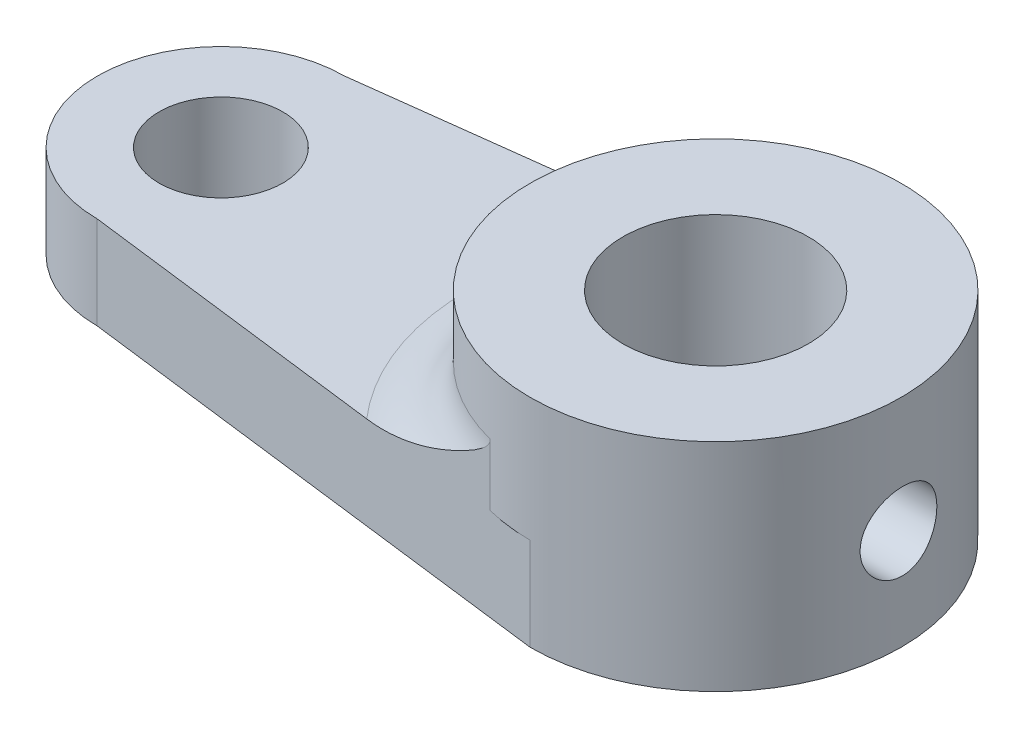
from build123d import *

# Parameters (mm, degrees)
SKETCH1_R                 = 3
SKETCH1_R_2               = 2
BOSS_EXTRUDE1_DEPTH       = 3
SKETCH2_R                 = 6
SKETCH2_R_2               = 3
BOSS_EXTRUDE2_DEPTH       = 4
FILLET1_R                 = 2
M3X0_5_TAPPED_HOLE1_D     = 2.5
M3X0_5_TAPPED_HOLE1_DEPTH = 7.5
M3X0_5_TAPPED_HOLE1_TIP   = 0.751075774


with BuildPart() as part:
    # Sketch1 → Boss-Extrude1 (new body)
    with BuildSketch(Plane(origin=(0, 0, 0), x_dir=(1, 0, 0), z_dir=(0, 1, 0))):
        with BuildLine():
            ThreePointArc((-51.426935745, 4), (-55.426935745, 0), (-51.426935745, -4))
            Line((-51.426935745, -4), (-35.426935745, -6))
            ThreePointArc((-35.426935745, -6), (-29.426935745, 0), (-35.426935745, 6))
            Line((-35.426935745, 6), (-51.426935745, 4))
        make_face()
        with Locations((-35.426935745, 0)):
            Circle(SKETCH1_R, mode=Mode.SUBTRACT)
        with Locations((-51.426935745, 0)):
            Circle(SKETCH1_R_2, mode=Mode.SUBTRACT)
    extrude(amount=BOSS_EXTRUDE1_DEPTH)

    # Sketch2 → Boss-Extrude2 (add)
    with BuildSketch(Plane(origin=(0, 3, 0), x_dir=(1, 0, 0), z_dir=(0, 1, 0))):
        with Locations((-35.426935745, 0)):
            Circle(SKETCH2_R)
        with Locations((-35.426935745, 0)):
            Circle(SKETCH2_R_2, mode=Mode.SUBTRACT)
    extrude(amount=BOSS_EXTRUDE2_DEPTH)

    # Fillet1
    fillet1_edges = [part.edges().sort_by_distance(p)[0] for p in [
        (-41.426935745, 3, 0),
    ]]
    fillet(fillet1_edges, radius=FILLET1_R)

    # M3x0.5 Tapped Hole1
    with Locations(Plane(origin=(-29.427105825, 3.231411819, -0.045176613), x_dir=(0.007529435543, 0, 0.999971653398), z_dir=(0.999971653398, 0, -0.007529435543))):
        with Locations((0, 0)):
            Hole(M3X0_5_TAPPED_HOLE1_D / 2, depth=M3X0_5_TAPPED_HOLE1_DEPTH)
            with Locations((0, 0, -(M3X0_5_TAPPED_HOLE1_DEPTH + M3X0_5_TAPPED_HOLE1_TIP / 2))):  # 118° drill point
                Cone(0, M3X0_5_TAPPED_HOLE1_D / 2, M3X0_5_TAPPED_HOLE1_TIP, mode=Mode.SUBTRACT)


solid = part.part
